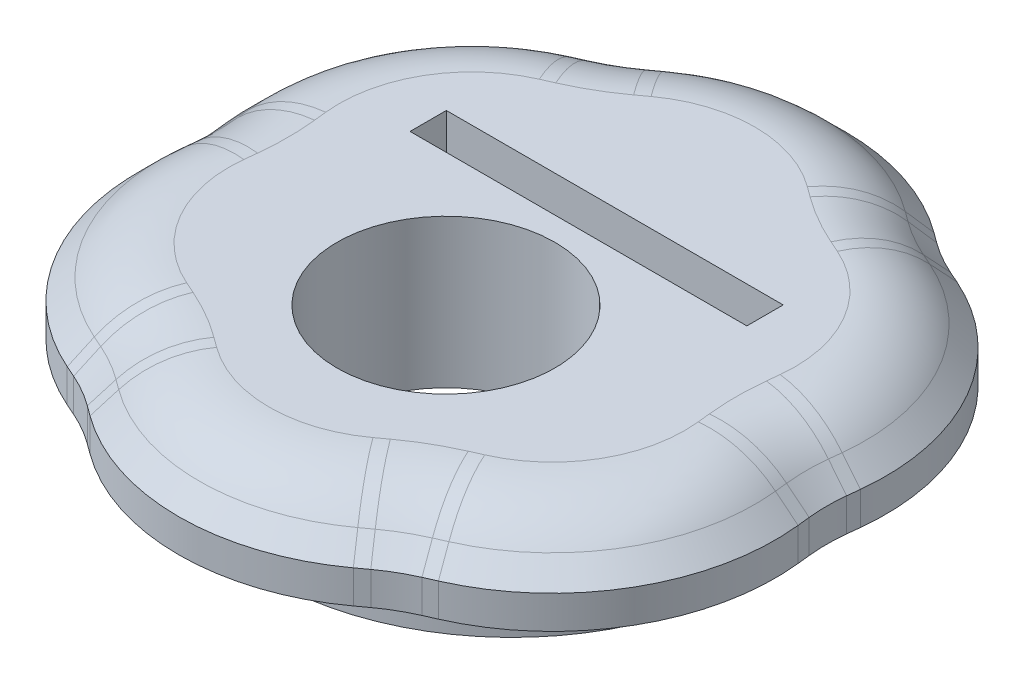
from build123d import *

# Parameters (mm, degrees)
EXTRUDE_1_DEPTH     = 3
CHAMFER_1_SIZE      = 4.5
SKETCH_3_R          = 14.75
SKETCH_3_R_2        = 14
EXTRUDE_2_DEPTH     = 6
FILLET_1_R          = 6
SKETCH_4_R          = 6.6
SKETCH_4_W          = 20.4
SKETCH_4_H          = 2.2
CUT_EXTRUDE_1_DEPTH = 10
SKETCH_5_R          = 7.5
SKETCH_5_R_2        = 6.6
EXTRUDE_3_DEPTH     = 6
EXTRUDE_4_DEPTH     = 2


with BuildPart() as part:
    # 草圖1 → 填料-伸長1 (new body)
    with BuildSketch(Plane(origin=(0, 0, 0), x_dir=(1, 0, 0), z_dir=(0, 1, 0))):
        with BuildLine():
            Line((-20.704980807, 1.724517645), (-20.623229371, 0.971941941))
            ThreePointArc((-20.623229371, 0.971941941), (-20.570593724, 0), (-20.623229371, -0.971941941))
            Line((-20.623229371, -0.971941941), (-20.704980807, -1.724517645))
            ThreePointArc((-20.704980807, -1.724517645), (-18.783087943, -10.84442088), (-11.845966493, -17.068780542))
            Line((-11.845966493, -17.068780542), (-11.153341097, -17.374269573))
            ThreePointArc((-11.153341097, -17.374269573), (-10.285296862, -17.814656736), (-9.469888273, -18.346211514))
            Line((-9.469888273, -18.346211514), (-8.859014314, -18.793298186))
            ThreePointArc((-8.859014314, -18.793298186), (0, -21.68884176), (8.859014314, -18.793298186))
            Line((8.859014314, -18.793298186), (9.469888273, -18.346211514))
            ThreePointArc((9.469888273, -18.346211514), (10.285296862, -17.814656736), (11.153341097, -17.374269573))
            Line((11.153341097, -17.374269573), (11.845966493, -17.068780542))
            ThreePointArc((11.845966493, -17.068780542), (18.783087943, -10.84442088), (20.704980807, -1.724517645))
            Line((20.704980807, -1.724517645), (20.623229371, -0.971941941))
            ThreePointArc((20.623229371, -0.971941941), (20.570593724, 0), (20.623229371, 0.971941941))
            Line((20.623229371, 0.971941941), (20.704980807, 1.724517645))
            ThreePointArc((20.704980807, 1.724517645), (18.783087943, 10.84442088), (11.845966493, 17.068780542))
            Line((11.845966493, 17.068780542), (11.153341097, 17.374269573))
            ThreePointArc((11.153341097, 17.374269573), (10.285296862, 17.814656736), (9.469888273, 18.346211514))
            Line((9.469888273, 18.346211514), (8.859014314, 18.793298186))
            ThreePointArc((8.859014314, 18.793298186), (0, 21.68884176), (-8.859014314, 18.793298186))
            Line((-8.859014314, 18.793298186), (-9.469888273, 18.346211514))
            ThreePointArc((-9.469888273, 18.346211514), (-10.285296862, 17.814656736), (-11.153341097, 17.374269573))
            Line((-11.153341097, 17.374269573), (-11.845966493, 17.068780542))
            ThreePointArc((-11.845966493, 17.068780542), (-18.783087943, 10.84442088), (-20.704980807, 1.724517645))
        make_face()
    extrude(amount=EXTRUDE_1_DEPTH)

    # 導角1
    # the kernel refuses this chamfer: 4.5 mm, written as the material it takes off along each edge
    with BuildSketch(Plane(origin=(0, 3, -6.68884176), x_dir=(0.5906009542707515, 0, -0.806963761772781), z_dir=(0.806963761772781, 0, 0.5906009542707515))) as chamfer_1_piece_1:
        Polygon((15, -CHAMFER_1_SIZE), (15 - CHAMFER_1_SIZE, 0), (15, 0), align=None)
    revolve(axis=Axis((0, 3, -6.68884176), (0, 1, 0)), revolution_arc=72.399330687, mode=Mode.SUBTRACT)
    with BuildSketch(Plane(origin=(-8.859014314, 3, -18.793298186), x_dir=(-0.01623909096472242, -0.9996219169112969, -0.022188176022919864), z_dir=(-0.8069637617728046, 0, 0.5906009542707192)), Plane(origin=(9.469888273, 3, -18.346211514), x_dir=(0.016239090964723243, -0.9996219169112966, -0.02218817602291905), z_dir=(-0.80696376177278, 0, -0.590600954270753)), Plane(origin=(-11.153341097, 3, -17.374269573), x_dir=(-0.011095978617127196, -0.9996219169112966, -0.025157553321276), z_dir=(-0.9149573107841905, 0, 0.4035506404933121)), Plane(origin=(11.845966493, 3, -17.068780542), x_dir=(0.01109597861712818, -0.9996219169112969, -0.025157553321275908), z_dir=(-0.9149573107841767, 0, -0.4035506404933432)), Plane(origin=(-20.704980807, 3, -1.724517645), x_dir=(-0.027335069581850155, -0.9996219169112966, 0.002969377298356834), z_dir=(0.10799354901140278, 0, 0.994151594764059)), Plane(origin=(20.623229371, 3, -0.971941941), x_dir=(0.027335069581850155, -0.9996219169112966, 0.002969377298356732), z_dir=(0.10799354901139908, 0, -0.9941515947640595)), Plane(origin=(-20.623229371, 3, 0.971941941), x_dir=(-0.027335069581850155, -0.9996219169112966, -0.0029693772983569343), z_dir=(-0.10799354901140637, 0, 0.9941515947640586)), Plane(origin=(20.704980807, 3, 1.724517645), x_dir=(0.027335069581850162, -0.9996219169112966, -0.0029693772983558834), z_dir=(-0.10799354901136858, 0, -0.9941515947640628)), Plane(origin=(-11.845966493, 3, 17.068780542), x_dir=(-0.011095978617126995, -0.9996219169112966, 0.025157553321276088), z_dir=(0.9149573107841937, 0, 0.40355064049330475)), Plane(origin=(11.153341097, 3, 17.374269573), x_dir=(0.01109597861712765, -0.9996219169112969, 0.025157553321275974), z_dir=(0.9149573107841842, 0, -0.40355064049332623)), Plane(origin=(-9.469888273, 3, 18.346211514), x_dir=(-0.016239090964723056, -0.9996219169112966, 0.022188176022919188), z_dir=(0.8069637617727851, 0, 0.5906009542707462)), Plane(origin=(8.859014314, 3, 18.793298186), x_dir=(0.016239090964721894, -0.9996219169112969, 0.022188176022919965), z_dir=(0.8069637617728149, 0, -0.5906009542707051))) as chamfer_1_piece_2:
        Polygon((CHAMFER_1_SIZE * 0.999621916911, CHAMFER_1_SIZE * 0.0274958766106), (-CHAMFER_1_SIZE * 0.0274958766106, CHAMFER_1_SIZE * 0.999621916911), (0, 0), align=None)
    extrude(amount=0.757002964, mode=Mode.SUBTRACT)
    with BuildSketch(Plane(origin=(-14.785296862, 3, -25.60888537), x_dir=(0.5906009542707458, 0, 0.8069637617727853), z_dir=(0.8069637617727853, 0, -0.5906009542707458))) as chamfer_1_piece_3:
        Polygon((9, CHAMFER_1_SIZE), (9 + CHAMFER_1_SIZE, 0), (9, 0), align=None)
    revolve(axis=Axis((-14.785296862, 3, -25.60888537), (0, -1, 0)), revolution_arc=12.399330687, mode=Mode.SUBTRACT)
    with BuildSketch(Plane(origin=(14.785296862, 3, -25.60888537), x_dir=(-0.4035506404933164, 0, 0.9149573107841885), z_dir=(0.9149573107841885, 0, 0.4035506404933164))) as chamfer_1_piece_4:
        Polygon((9, CHAMFER_1_SIZE), (9 + CHAMFER_1_SIZE, 0), (9, 0), align=None)
    revolve(axis=Axis((14.785296862, 3, -25.60888537), (0, -1, 0)), revolution_arc=12.399330687, mode=Mode.SUBTRACT)
    with BuildSketch(Plane(origin=(-5.792706886, 3, -3.34442088), x_dir=(-0.40355064049330586, 0, -0.9149573107841932), z_dir=(0.9149573107841932, 0, -0.40355064049330586))) as chamfer_1_piece_5:
        Polygon((15, -CHAMFER_1_SIZE), (15 - CHAMFER_1_SIZE, 0), (15, 0), align=None)
    revolve(axis=Axis((-5.792706886, 3, -3.34442088), (0, 1, 0)), revolution_arc=72.399330687, mode=Mode.SUBTRACT)
    with BuildSketch(Plane(origin=(5.792706886, 3, -3.34442088), x_dir=(0.9941515947640585, 0, 0.10799354901140852), z_dir=(-0.10799354901140852, 0, 0.9941515947640585))) as chamfer_1_piece_6:
        Polygon((15, -CHAMFER_1_SIZE), (15 - CHAMFER_1_SIZE, 0), (15, 0), align=None)
    revolve(axis=Axis((5.792706886, 3, -3.34442088), (0, 1, 0)), revolution_arc=72.399330687, mode=Mode.SUBTRACT)
    with BuildSketch(Plane(origin=(-29.570593724, 3, 0), x_dir=(0.994151594764055, 0, -0.10799354901143883), z_dir=(-0.10799354901143883, 0, -0.994151594764055))) as chamfer_1_piece_7:
        Polygon((9, CHAMFER_1_SIZE), (9 + CHAMFER_1_SIZE, 0), (9, 0), align=None)
    revolve(axis=Axis((-29.570593724, 3, 0), (0, -1, 0)), revolution_arc=12.399330687, mode=Mode.SUBTRACT)
    with BuildSketch(Plane(origin=(29.570593724, 3, 0), x_dir=(-0.9941515947640606, 0, 0.10799354901138845), z_dir=(0.10799354901138845, 0, 0.9941515947640606))) as chamfer_1_piece_8:
        Polygon((9, CHAMFER_1_SIZE), (9 + CHAMFER_1_SIZE, 0), (9, 0), align=None)
    revolve(axis=Axis((29.570593724, 3, 0), (0, -1, 0)), revolution_arc=12.399330687, mode=Mode.SUBTRACT)
    with BuildSketch(Plane(origin=(-5.792706886, 3, 3.34442088), x_dir=(-0.9941515947640578, 0, -0.10799354901141427), z_dir=(0.10799354901141427, 0, -0.9941515947640578))) as chamfer_1_piece_9:
        Polygon((15, -CHAMFER_1_SIZE), (15 - CHAMFER_1_SIZE, 0), (15, 0), align=None)
    revolve(axis=Axis((-5.792706886, 3, 3.34442088), (0, 1, 0)), revolution_arc=72.399330687, mode=Mode.SUBTRACT)
    with BuildSketch(Plane(origin=(5.792706886, 3, 3.34442088), x_dir=(0.4035506404933115, 0, 0.9149573107841906), z_dir=(-0.9149573107841906, 0, 0.4035506404933115))) as chamfer_1_piece_10:
        Polygon((15, -CHAMFER_1_SIZE), (15 - CHAMFER_1_SIZE, 0), (15, 0), align=None)
    revolve(axis=Axis((5.792706886, 3, 3.34442088), (0, 1, 0)), revolution_arc=72.399330687, mode=Mode.SUBTRACT)
    with BuildSketch(Plane(origin=(-14.785296862, 3, 25.60888537), x_dir=(0.40355064049333084, 0, -0.9149573107841821), z_dir=(-0.9149573107841821, 0, -0.40355064049333084))) as chamfer_1_piece_11:
        Polygon((9, CHAMFER_1_SIZE), (9 + CHAMFER_1_SIZE, 0), (9, 0), align=None)
    revolve(axis=Axis((-14.785296862, 3, 25.60888537), (0, -1, 0)), revolution_arc=12.399330687, mode=Mode.SUBTRACT)
    with BuildSketch(Plane(origin=(14.785296862, 3, 25.60888537), x_dir=(-0.5906009542707462, 0, -0.8069637617727851), z_dir=(-0.8069637617727851, 0, 0.5906009542707462))) as chamfer_1_piece_12:
        Polygon((9, CHAMFER_1_SIZE), (9 + CHAMFER_1_SIZE, 0), (9, 0), align=None)
    revolve(axis=Axis((14.785296862, 3, 25.60888537), (0, -1, 0)), revolution_arc=12.399330687, mode=Mode.SUBTRACT)
    with BuildSketch(Plane(origin=(0, 3, 6.68884176), x_dir=(-0.5906009542707469, 0, 0.8069637617727844), z_dir=(-0.8069637617727844, 0, -0.5906009542707469))) as chamfer_1_piece_13:
        Polygon((15, -CHAMFER_1_SIZE), (15 - CHAMFER_1_SIZE, 0), (15, 0), align=None)
    revolve(axis=Axis((0, 3, 6.68884176), (0, 1, 0)), revolution_arc=72.399330687, mode=Mode.SUBTRACT)

    # 草圖3 → 填料-伸長2 (add)
    with BuildSketch(Plane.XZ):
        with Locations(Location((0, 0, 0), (0, 0, 90))):
            Circle(SKETCH_3_R)
        with Locations(Location((0, 0, 0), (0, 0, 270))):
            Circle(SKETCH_3_R_2, mode=Mode.SUBTRACT)
    extrude(amount=EXTRUDE_2_DEPTH)

    # 圓角1
    fillet_1_edges = [part.edges().sort_by_distance(p)[0] for p in [
        (0, 3, 17.18884176),
        (6.506746999, 3, 14.938417922),
        (-6.506746999, 3, 14.938417922),
        (8.035296862, 3, 13.917542418),
        (-8.035296862, 3, 13.917542418),
        (9.683675913, 3, 13.104217159),
        (-9.683675913, 3, 13.104217159),
        (14.885973626, 3, 8.59442088),
        (-14.885973626, 3, 8.59442088),
        (16.190422913, 3, 1.834200763),
        (-16.190422913, 3, 1.834200763),
        (16.070593724, 3, 0),
        (-16.070593724, 3, 0),
        (16.190422913, 3, -1.834200763),
        (-16.190422913, 3, -1.834200763),
        (14.885973626, 3, -8.59442088),
        (-14.885973626, 3, -8.59442088),
        (9.683675913, 3, -13.104217159),
        (-9.683675913, 3, -13.104217159),
        (8.035296862, 3, -13.917542418),
        (-8.035296862, 3, -13.917542418),
        (6.506746999, 3, -14.938417922),
        (-6.506746999, 3, -14.938417922),
        (0, 3, -17.18884176),
    ]]
    fillet(fillet_1_edges, radius=FILLET_1_R)

    # 草圖4 → 除料-伸長1 (cut)
    with BuildSketch(Plane(origin=(0, 3, 0), x_dir=(1, 0, 0), z_dir=(0, 1, 0))):
        with Locations(Location((0, -4, 0), (0, 0, 270))):
            Circle(SKETCH_4_R)
        with Locations((0, 5.12397969)):
            Rectangle(SKETCH_4_W, SKETCH_4_H)
    extrude(amount=-CUT_EXTRUDE_1_DEPTH, mode=Mode.SUBTRACT)

    # 草圖5 → 填料-伸長3 (add)
    with BuildSketch(Plane.XZ):
        with Locations(Location((0, 4, 0), (0, 0, 90))):
            Circle(SKETCH_5_R)
        with Locations(Location((0, 4, 0), (0, 0, 90))):
            Circle(SKETCH_5_R_2, mode=Mode.SUBTRACT)
    extrude(amount=EXTRUDE_3_DEPTH)

    # 草圖6 → 填料-伸長4 (add)
    with BuildSketch(Plane.XZ):
        with BuildLine():
            Line((-8.583986842, -17.135765871), (-7.973112883, -17.582852544))
            ThreePointArc((-7.973112883, -17.582852544), (0, -20.18884176), (7.973112883, -17.582852544))
            Line((7.973112883, -17.582852544), (8.583986842, -17.135765871))
            ThreePointArc((8.583986842, -17.135765871), (9.535296862, -16.51561863), (10.548015137, -16.001833606))
            Line((10.548015137, -16.001833606), (11.240640533, -15.696344575))
            ThreePointArc((11.240640533, -15.696344575), (17.484049837, -10.09442088), (19.213753415, -1.886507968))
            Line((19.213753415, -1.886507968), (19.132001979, -1.133932265))
            ThreePointArc((19.132001979, -1.133932265), (19.070593724, 0), (19.132001979, 1.133932265))
            Line((19.132001979, 1.133932265), (19.213753415, 1.886507968))
            ThreePointArc((19.213753415, 1.886507968), (17.484049837, 10.09442088), (11.240640533, 15.696344575))
            Line((11.240640533, 15.696344575), (10.548015137, 16.001833606))
            ThreePointArc((10.548015137, 16.001833606), (9.535296862, 16.51561863), (8.583986842, 17.135765871))
            Line((8.583986842, 17.135765871), (7.973112883, 17.582852544))
            ThreePointArc((7.973112883, 17.582852544), (0, 20.18884176), (-7.973112883, 17.582852544))
            Line((-7.973112883, 17.582852544), (-8.583986842, 17.135765871))
            ThreePointArc((-8.583986842, 17.135765871), (-9.535296862, 16.51561863), (-10.548015137, 16.001833606))
            Line((-10.548015137, 16.001833606), (-11.240640533, 15.696344575))
            ThreePointArc((-11.240640533, 15.696344575), (-17.484049837, 10.09442088), (-19.213753415, 1.886507968))
            Line((-19.213753415, 1.886507968), (-19.132001979, 1.133932265))
            ThreePointArc((-19.132001979, 1.133932265), (-19.070593724, 0), (-19.132001979, -1.133932265))
            Line((-19.132001979, -1.133932265), (-19.213753415, -1.886507968))
            ThreePointArc((-19.213753415, -1.886507968), (-17.484049837, -10.09442088), (-11.240640533, -15.696344575))
            Line((-11.240640533, -15.696344575), (-10.548015137, -16.001833606))
            ThreePointArc((-10.548015137, -16.001833606), (-9.535296862, -16.51561863), (-8.583986842, -17.135765871))
        make_face()
        with BuildLine():
            Line((-7.993385888, -16.328802109), (-7.382511928, -16.775888782))
            ThreePointArc((-7.382511928, -16.775888782), (0, -19.18884176), (7.382511928, -16.775888782))
            Line((7.382511928, -16.775888782), (7.993385888, -16.328802109))
            ThreePointArc((7.993385888, -16.328802109), (9.035296862, -15.649593226), (10.144464496, -15.086876296))
            Line((10.144464496, -15.086876296), (10.837089892, -14.781387265))
            ThreePointArc((10.837089892, -14.781387265), (16.618024433, -9.59442088), (18.21960182, -1.994501517))
            Line((18.21960182, -1.994501517), (18.137850384, -1.241925814))
            ThreePointArc((18.137850384, -1.241925814), (18.070593724, 0), (18.137850384, 1.241925814))
            Line((18.137850384, 1.241925814), (18.21960182, 1.994501517))
            ThreePointArc((18.21960182, 1.994501517), (16.618024433, 9.59442088), (10.837089892, 14.781387265))
            Line((10.837089892, 14.781387265), (10.144464496, 15.086876296))
            ThreePointArc((10.144464496, 15.086876296), (9.035296862, 15.649593226), (7.993385888, 16.328802109))
            Line((7.993385888, 16.328802109), (7.382511928, 16.775888782))
            ThreePointArc((7.382511928, 16.775888782), (0, 19.18884176), (-7.382511928, 16.775888782))
            Line((-7.382511928, 16.775888782), (-7.993385888, 16.328802109))
            ThreePointArc((-7.993385888, 16.328802109), (-9.035296862, 15.649593226), (-10.144464496, 15.086876296))
            Line((-10.144464496, 15.086876296), (-10.837089892, 14.781387265))
            ThreePointArc((-10.837089892, 14.781387265), (-16.618024433, 9.59442088), (-18.21960182, 1.994501517))
            Line((-18.21960182, 1.994501517), (-18.137850384, 1.241925814))
            ThreePointArc((-18.137850384, 1.241925814), (-18.070593724, 0), (-18.137850384, -1.241925814))
            Line((-18.137850384, -1.241925814), (-18.21960182, -1.994501517))
            ThreePointArc((-18.21960182, -1.994501517), (-16.618024433, -9.59442088), (-10.837089892, -14.781387265))
            Line((-10.837089892, -14.781387265), (-10.144464496, -15.086876296))
            ThreePointArc((-10.144464496, -15.086876296), (-9.035296862, -15.649593226), (-7.993385888, -16.328802109))
        make_face(mode=Mode.SUBTRACT)
    extrude(amount=EXTRUDE_4_DEPTH)


solid = part.part
